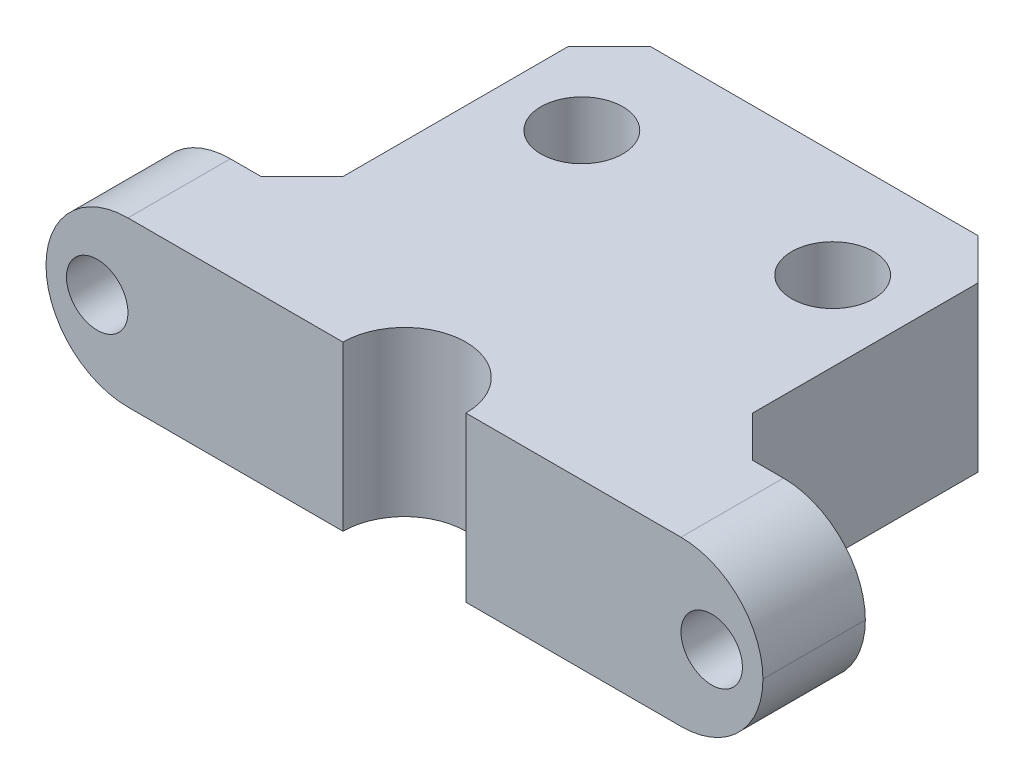
from build123d import *

# Parameters (mm, degrees)
BOSS_EXTRUDE1_DEPTH = 8
CHAMFER1_SIZE       = 2
SKETCH2_R           = 1.5
CUT_EXTRUDE1_DEPTH  = 25.397745798
FILLET1_R           = 4
SKETCH3_R           = 2
CUT_EXTRUDE2_DEPTH  = 28.753378173
CHAMFER2_SIZE       = 2


with BuildPart() as part:
    # Sketch1 → Boss-Extrude1 (new body)
    with BuildSketch(Plane(origin=(0, 0, 0), x_dir=(1, 0, 0), z_dir=(0, 1, 0))):
        with BuildLine():
            Line((10, 20), (-10, 20))
            Line((-10, 20), (-10, 5))
            Line((-10, 5), (-17.5, 5))
            Line((-17.5, 5), (-17.5, 0))
            Line((-17.5, 0), (-3, 0))
            ThreePointArc((-3, 0), (0, 3), (3, 0))
            Line((3, 0), (17.5, 0))
            Line((17.5, 0), (17.5, 5))
            Line((17.5, 5), (10, 5))
            Line((10, 5), (10, 20))
        make_face()
    extrude(amount=BOSS_EXTRUDE1_DEPTH)

    # Chamfer1
    chamfer1_edges = [part.edges().sort_by_distance(p)[0] for p in [
        (-10, 4, -5),
        (10, 4, -5),
    ]]
    chamfer(chamfer1_edges, length=CHAMFER1_SIZE)

    # Sketch2 → Cut-Extrude1 (cut, through all)
    with BuildSketch(Plane(origin=(0, 0, -5), x_dir=(-1, 0, 0), z_dir=(0, 0, -1))):
        with Locations((-15, 4)):
            Circle(SKETCH2_R)
        with Locations((15, 4)):
            Circle(SKETCH2_R)
    extrude(amount=-CUT_EXTRUDE1_DEPTH, mode=Mode.SUBTRACT)

    # Fillet1
    fillet1_edges = [part.edges().sort_by_distance(p)[0] for p in [
        (17.5, 8, -2.5),
        (-17.5, 8, -2.5),
        (17.5, 0, -2.5),
        (-17.5, 0, -2.5),
    ]]
    fillet(fillet1_edges, radius=FILLET1_R - 0.0001)  # a hair under: the kernel refuses the full size

    # Sketch3 → Cut-Extrude2 (cut, through all)
    with BuildSketch(Plane(origin=(0, 8, 0), x_dir=(1, 0, 0), z_dir=(0, 1, 0))):
        with Locations(Location((-6.122934918, 14.78207252, 0), (0, 0, 270))):
            Circle(SKETCH3_R)
        with Locations(Location((6.122934918, 14.78207252, 0), (0, 0, 270))):
            Circle(SKETCH3_R)
    extrude(amount=-CUT_EXTRUDE2_DEPTH, mode=Mode.SUBTRACT)

    # Chamfer2
    chamfer2_edges = [part.edges().sort_by_distance(p)[0] for p in [
        (-10, 4, -20),
        (10, 4, -20),
    ]]
    chamfer(chamfer2_edges, length=CHAMFER2_SIZE)


solid = part.part
